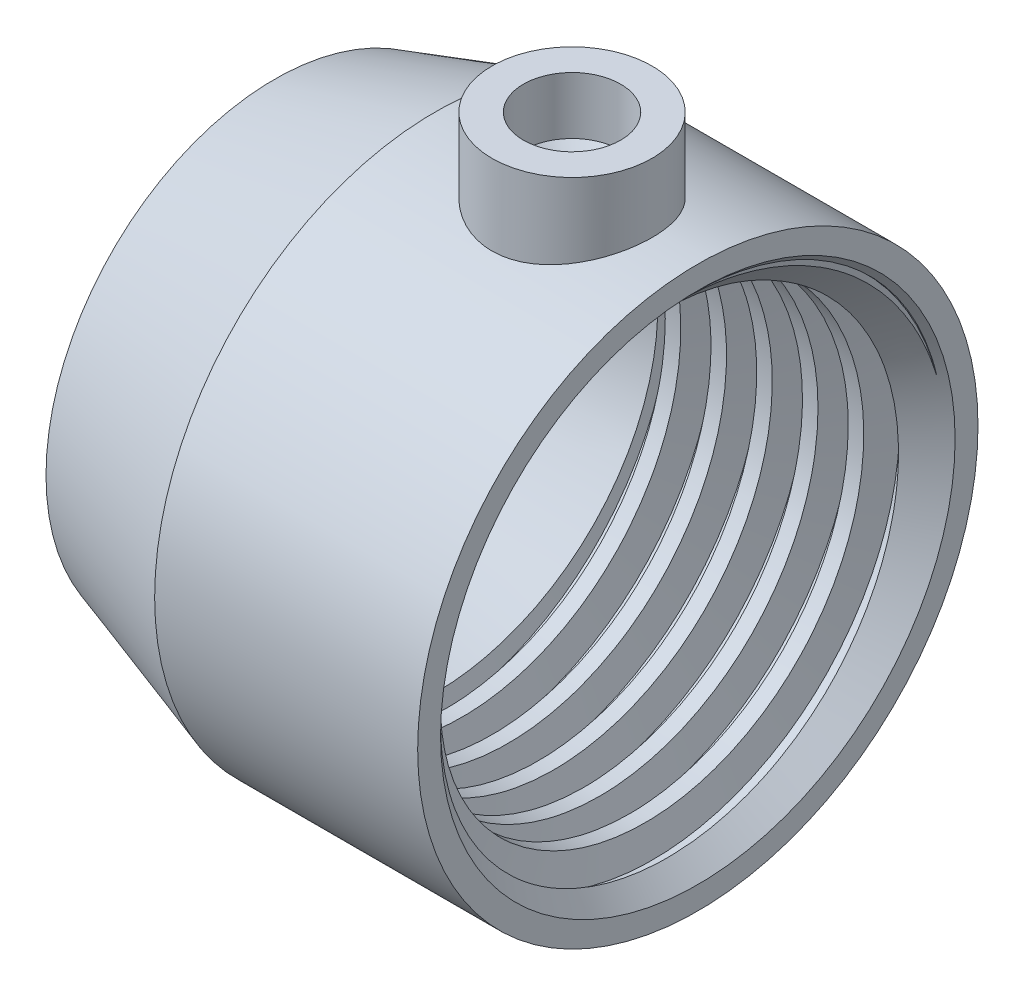
from build123d import *

# Parameters (mm, degrees)
CHAMFER1_SIZE              = 3
CUT_SWEEP4_PITCH           = 4
BOSS_EXTRUDE1_REACH        = 72.67
BOSS_EXTRUDE1_END_RADIUS   = 24.5
SKETCH11_R                 = 7
M10X1_5_TAPPED_HOLE1_D     = 8.5
M10X1_5_TAPPED_HOLE1_DEPTH = 5
M10X1_5_TAPPED_HOLE1_TIP   = 4.25


with BuildPart() as part:
    # Sketch1 → Revolve1 (revolve)
    with BuildSketch(Plane.XY, mode=Mode.PRIVATE) as revolve1_sk:
        Polygon((0, 13.5), (0, 20), (14, 24.5), (37, 24.5), (37, 19.5), (14, 19.5), (3, 15.964285714), (3, 13.5), align=None)
    revolve(revolve1_sk.sketch.rotate(Axis((0, 0, 0), (1, 0, 0)), 90), axis=Axis((0, 0, 0), (1, 0, 0)))

    # Chamfer1
    chamfer1_edges = [part.edges().sort_by_distance(p)[0] for p in [
        (37, 0, -19.5),
    ]]
    chamfer(chamfer1_edges, length=CHAMFER1_SIZE)

    # Cut-Sweep4: arcs per turn and ends read off the stored shape
    # Cut-Sweep4: the profile of Sketch9 profile screwed along a left-hand helix through 6.5 turns, 12 arcs to a turn; built about Z, then put on its axis
    cut_sweep4_z = Axis((0, 0, 0), (0, 0, 1))
    cut_sweep4_corners = [(19.4997, 0, 7.7585e-05), (19.4997, 0, -2.643165507), (22, 0, -1.996543961), (22, 0, -0.646543961)]
    with BuildLine(mode=Mode.PRIVATE) as cut_sweep4_profile:
        Line(cut_sweep4_corners[0], cut_sweep4_corners[1])
        Line(cut_sweep4_corners[1], cut_sweep4_corners[2])
        Line(cut_sweep4_corners[2], cut_sweep4_corners[3])
        Line(cut_sweep4_corners[3], cut_sweep4_corners[0])
    cut_sweep4_cap = Face(cut_sweep4_profile.wire())
    cut_sweep4_turn_angles = [0, -15, -30, -45, -60, -75, -90, -105, -120, -135, -150, -165, -180, -195, -210, -225, -240, -255, -270, -285, -300, -315, -330, -345, -360]
    cut_sweep4_turn_weights = [1, 0.9659258262890683, 1, 0.9659258262890683, 1, 0.9659258262890683, 1, 0.9659258262890683, 1, 0.9659258262890683, 1, 0.9659258262890683, 1, 0.9659258262890683, 1, 0.9659258262890683, 1, 0.9659258262890683, 1, 0.9659258262890683, 1, 0.9659258262890683, 1, 0.9659258262890683, 1]
    cut_sweep4_turn_rails = [Edge.make_bspline([Vector(p[0], p[1], 0).rotate(cut_sweep4_z, cut_sweep4_turn_angles[k]) / cut_sweep4_turn_weights[k] + Vector(0, 0, p[2] + -CUT_SWEEP4_PITCH * cut_sweep4_turn_angles[k] / 360) for k in range(25)], [0, 0, 0, 1, 1, 2, 2, 3, 3, 4, 4, 5, 5, 6, 6, 7, 7, 8, 8, 9, 9, 10, 10, 11, 11, 12, 12, 12], 2, cut_sweep4_turn_weights) for p in cut_sweep4_corners]
    cut_sweep4_turn_sides = [Face.make_surface_from_curves(cut_sweep4_turn_rails[p[0]], cut_sweep4_turn_rails[p[1]]) for p in [(0, 1), (1, 2), (2, 3), (3, 0)]]
    cut_sweep4_last_angles = [-2160, -2175, -2190, -2205, -2220, -2235, -2250, -2265, -2280, -2295, -2310, -2325, -2340]
    cut_sweep4_last_weights = [1, 0.9659258262890683, 1, 0.9659258262890683, 1, 0.9659258262890683, 1, 0.9659258262890683, 1, 0.9659258262890683, 1, 0.9659258262890683, 1]
    cut_sweep4_last_rails = [Edge.make_bspline([Vector(p[0], p[1], 0).rotate(cut_sweep4_z, cut_sweep4_last_angles[k]) / cut_sweep4_last_weights[k] + Vector(0, 0, p[2] + -CUT_SWEEP4_PITCH * cut_sweep4_last_angles[k] / 360) for k in range(13)], [0, 0, 0, 1, 1, 2, 2, 3, 3, 4, 4, 5, 5, 6, 6, 6], 2, cut_sweep4_last_weights) for p in cut_sweep4_corners]
    cut_sweep4_last_sides = [Face.make_surface_from_curves(cut_sweep4_last_rails[p[0]], cut_sweep4_last_rails[p[1]]) for p in [(0, 1), (1, 2), (2, 3), (3, 0)]]
    cut_sweep4 = Plane(origin=(37, 0, 0), x_dir=(0, -1, 0), z_dir=(-1, 0, 0)) * Solid(Shell([*[p.moved(Location((0, 0, CUT_SWEEP4_PITCH * i))) for i in range(6) for p in cut_sweep4_turn_sides], *cut_sweep4_last_sides, cut_sweep4_cap, cut_sweep4_cap.rotate(cut_sweep4_z, -2340).moved(Location((0, 0, -CUT_SWEEP4_PITCH * -2340 / 360)))]))
    add(cut_sweep4, mode=Mode.SUBTRACT)

    # Boss-Extrude1: up to this cylinder (the profile starts outside it)
    boss_extrude1_end = Plane(origin=(26, 0, 0), z_dir=(-1, 0, 0)) * Cylinder(BOSS_EXTRUDE1_END_RADIUS, 195.34, mode=Mode.PRIVATE)
    # Sketch11 → Boss-Extrude1 (add, up to the surface)
    with BuildSketch(Plane(origin=(0, 30.5, 0), x_dir=(1, 0, 0), z_dir=(0, 1, 0)), mode=Mode.PRIVATE) as boss_extrude1_sk1:
        with Locations(Location((26, 0, 0), (0, 0, 270))):
            Circle(SKETCH11_R)
    boss_extrude1_tool1 = extrude(boss_extrude1_sk1.sketch, amount=-BOSS_EXTRUDE1_REACH, mode=Mode.PRIVATE) - boss_extrude1_end
    add(boss_extrude1_tool1.solids().sort_by_distance((26, 30.5, 0))[0])

    # M10x1.5 Tapped Hole1
    with Locations(Plane(origin=(0, 30.5, 0), x_dir=(1, 0, 0), z_dir=(0, 1, 0))):
        with Locations((26, 0)):
            Hole(M10X1_5_TAPPED_HOLE1_D / 2, depth=M10X1_5_TAPPED_HOLE1_DEPTH)
            with Locations((0, 0, -(M10X1_5_TAPPED_HOLE1_DEPTH + M10X1_5_TAPPED_HOLE1_TIP / 2))):  # 90° drill point
                Cone(0, M10X1_5_TAPPED_HOLE1_D / 2, M10X1_5_TAPPED_HOLE1_TIP, mode=Mode.SUBTRACT)


solid = part.part
